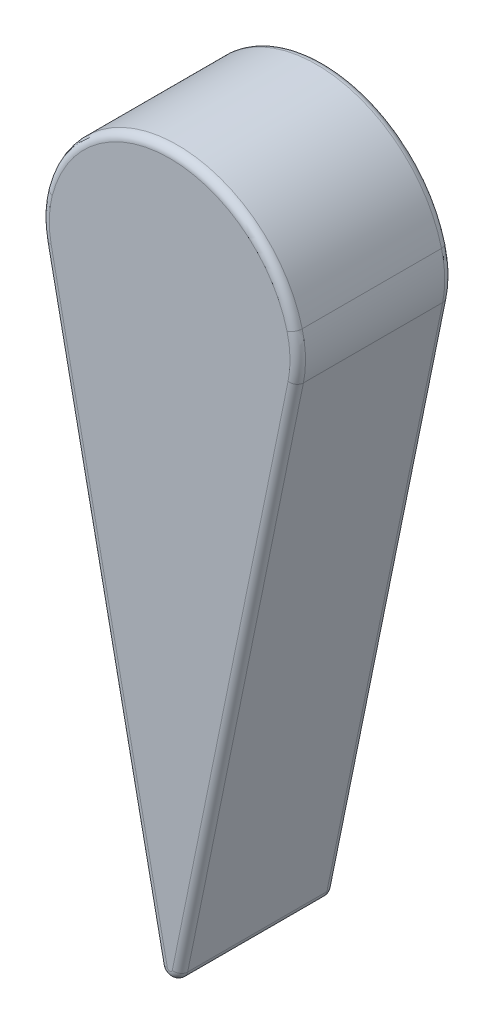
from build123d import *

# Parameters (mm, degrees)
BOSS_EXTRUDE1_DEPTH = 0.6
FILLET1_R           = 0.04
FILLET2_R           = 0.4
FILLET3_R           = 0.03


with BuildPart() as part:
    # Sketch1 → Boss-Extrude1 (new body)
    with BuildSketch(Plane.XY):
        with BuildLine():
            ThreePointArc((0.5, 0), (0, 0.5), (-0.5, 0))
            Line((-0.5, 0), (0.000658427, -2.449624051))
            Line((0.000658427, -2.449624051), (0.5, 0))
        make_face()
    extrude(amount=BOSS_EXTRUDE1_DEPTH)

    # Fillet1
    fillet1_edges = [part.edges().sort_by_distance(p)[0] for p in [
        (0.000658427, -2.449624051, 0.3),
    ]]
    fillet(fillet1_edges, radius=FILLET1_R)

    # Fillet2
    fillet2_edges = [part.edges().sort_by_distance(p)[0] for p in [
        (0.5, 0, 0.3),
        (-0.5, 0, 0.3),
    ]]
    fillet(fillet2_edges, radius=FILLET2_R)

    # Fillet3
    fillet3_edges = [part.edges().sort_by_distance(p)[0] for p in [
        (-0.496704937, 0.035107522, 0),
        (-0.263657572, -1.156377414, 0),
        (0.000617138, -2.289613516, 0),
        (0.26429535, -1.156298236, 0),
        (0.496722188, 0.035014178, 0),
        (0.00016555, 0.499999973, 0),
        (0.000617138, -2.289613516, 0.6),
        (-0.263657572, -1.156377414, 0.6),
        (-0.496704937, 0.035107522, 0.6),
        (0.00016555, 0.499999973, 0.6),
        (0.496722188, 0.035014178, 0.6),
        (0.26429535, -1.156298236, 0.6),
    ]]
    fillet(fillet3_edges, radius=FILLET3_R)


solid = part.part
